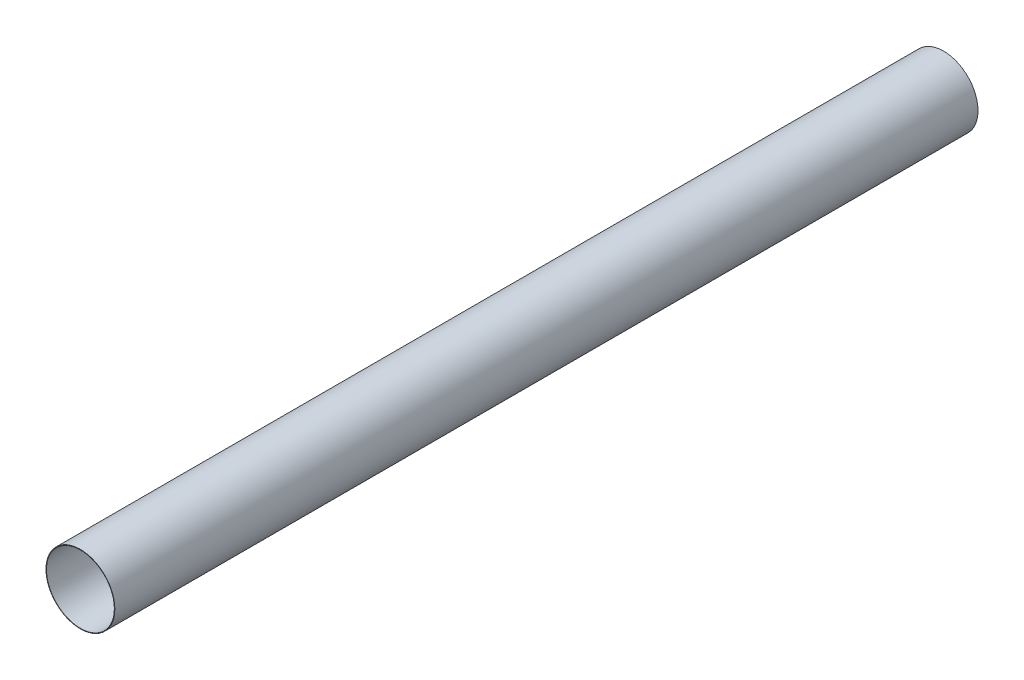
from build123d import *

# Parameters (mm, degrees)
SKETCH1_R           = 72
SKETCH1_R_2         = 71
BOSS_EXTRUDE1_DEPTH = 1804


with BuildPart() as part:
    # Sketch1 → Boss-Extrude1 (new body)
    with BuildSketch(Plane.XY):
        Circle(SKETCH1_R)
        Circle(SKETCH1_R_2, mode=Mode.SUBTRACT)
    extrude(amount=BOSS_EXTRUDE1_DEPTH)


solid = part.part
